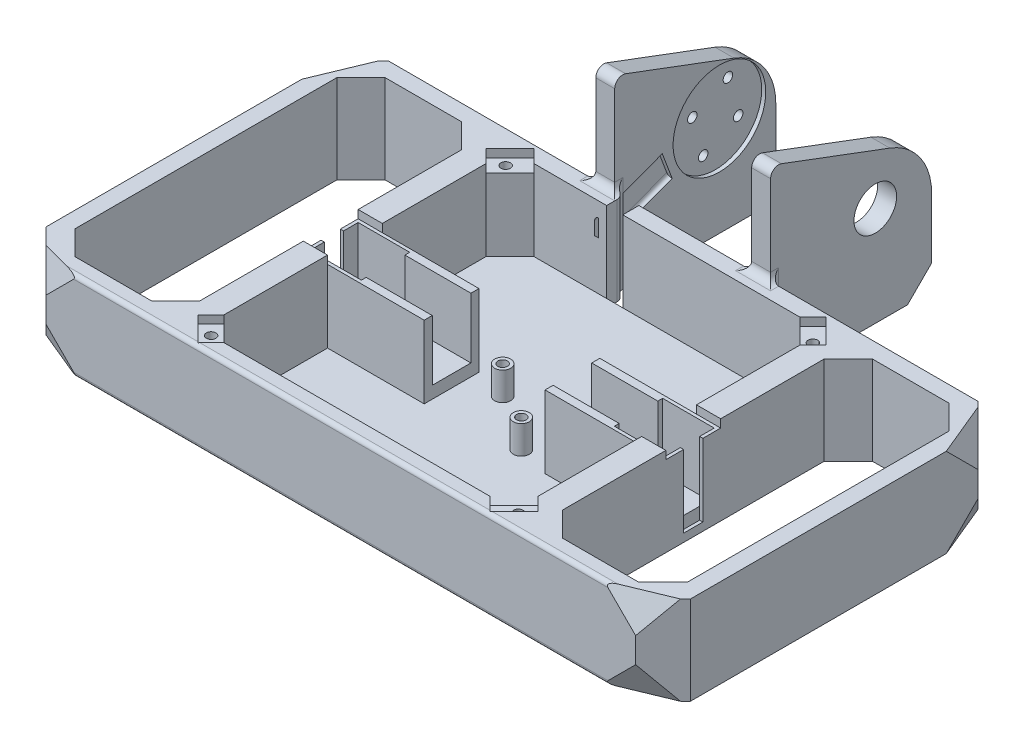
from build123d import *

# Parameters (mm, degrees)
BOSS_EXTRUDE1_DEPTH      = 25.4
BOSS_EXTRUDE1_DEPTH_BACK = 2.54
SKETCH1_W                = 7.62
SKETCH1_H                = 40.259
BOSS_EXTRUDE2_DEPTH      = 2.54
SKETCH4_W                = 1.016
SKETCH4_H                = 3.048
SKETCH4_H_2              = 1.524
BOSS_EXTRUDE3_DEPTH      = 22.86
BOSS_EXTRUDE4_DEPTH      = 5.969
FILLET1_R                = 2.54
FILLET2_R                = 2.54
FILLET3_R                = 20.32
CHAMFER1_SIZE            = 7.62
CHAMFER2_SIZE            = 7.62
CHAMFER3_SIZE            = 7.62
SKETCH7_R                = 14.605
CUT_EXTRUDE2_DEPTH       = 1.27
SKETCH8_R                = 6.731
SKETCH8_R_2              = 2.921
CUT_EXTRUDE3_DEPTH       = 12.7
FILLET5_R                = 2.54
CUT_EXTRUDE4_DEPTH       = 2.54
SKETCH10_R               = 1.5
CUT_EXTRUDE5_DEPTH       = 7.62
SKETCH11_R               = 1.5
CUT_EXTRUDE7_DEPTH       = 7.62
SKETCH12_W               = 5.08
SKETCH12_H               = 27.94
CUT_EXTRUDE8_DEPTH       = 5.08
SKETCH11_3_R             = 2.77
SKETCH11_3_R_2           = 1.5
CUT_EXTRUDE10_DEPTH      = 2.54
SKETCH14_R               = 2.516
SKETCH14_R_2             = 1.5
BOSS_EXTRUDE5_DEPTH      = 8.89
FILLET6_R                = 2.54
CUT_EXTRUDE11_DEPTH      = 1.27
BOSS_EXTRUDE6_DEPTH      = 3.81
FILLET9_R                = 1.27
SKETCH13_R               = 1.5
CUT_EXTRUDE12_DEPTH      = 4.699
FILLET10_R               = 1.27
CHAMFER5_SIZE            = 8.636
CHAMFER6_START           = -81
CHAMFER6_OUTLINE_W       = 17
CHAMFER6_OUTLINE_H       = 13
CHAMFER6_DEPTH           = 3.614919147
CHAMFER7_START           = 85.302688349
CHAMFER7_OUTLINE_W       = 21
CHAMFER7_OUTLINE_H       = 15
CHAMFER7_DEPTH           = 4.697311651
CHAMFER8_START           = 109.374719125
CHAMFER8_OUTLINE_W       = 17
CHAMFER8_OUTLINE_H       = 17
CHAMFER8_DEPTH           = 4.625280875
CHAMFER9_START           = -114
CHAMFER9_OUTLINE_W       = 17
CHAMFER9_OUTLINE_H       = 17
CHAMFER9_DEPTH           = 4.625280875
CHAMFER10_START          = -106
CHAMFER10_OUTLINE_W      = 17
CHAMFER10_OUTLINE_H      = 17
CHAMFER10_DEPTH          = 4.79559905
CHAMFER11_START          = 101.20440095
CHAMFER11_OUTLINE_W      = 17
CHAMFER11_OUTLINE_H      = 17
CHAMFER11_DEPTH          = 4.79559905
CHAMFER12_START          = 77.132370173
CHAMFER12_OUTLINE_W      = 21
CHAMFER12_OUTLINE_H      = 15
CHAMFER12_DEPTH          = 4.867629827
CHAMFER13_START          = -82
CHAMFER13_OUTLINE_W      = 21
CHAMFER13_OUTLINE_H      = 15
CHAMFER13_DEPTH          = 4.867629827
FILLET12_R               = 1.27


with BuildPart() as part:
    # Sketch1 → Boss-Extrude1 (new, two sides: drawn at the far end of the back side and taken through both)
    with BuildSketch(Plane(origin=(0, 0, 0), x_dir=(1, 0, 0), z_dir=(0, 1, 0)).offset(-BOSS_EXTRUDE1_DEPTH_BACK)):
        Polygon((-96.52, 48.895), (-57.15, 48.895), (-57.15, 53.975), (-101.6, 53.975), (-101.6, -53.975), (-57.15, -53.975), (-57.15, -48.895), (-96.52, -48.895), align=None)
        Polygon((-49.53, 48.895), (49.53, 48.895), (57.15, 48.895), (57.15, 53.975), (-57.15, 53.975), (-57.15, 48.895), align=None)
        Polygon((57.15, -53.975), (57.15, -48.895), (49.53, -48.895), (-49.53, -48.895), (-57.15, -48.895), (-57.15, -53.975), align=None)
        Polygon((57.15, 53.975), (57.15, 48.895), (96.52, 48.895), (96.52, -48.895), (57.15, -48.895), (57.15, -53.975), (101.6, -53.975), (101.6, 53.975), align=None)
        with Locations((-53.34, 28.7655)):
            Rectangle(SKETCH1_W, SKETCH1_H)
        with Locations((-53.34, -28.7655)):
            Rectangle(SKETCH1_W, SKETCH1_H)
        with Locations((53.34, 28.7655)):
            Rectangle(SKETCH1_W, SKETCH1_H)
        with Locations((53.34, -28.7655)):
            Rectangle(SKETCH1_W, SKETCH1_H)
    extrude(amount=BOSS_EXTRUDE1_DEPTH + BOSS_EXTRUDE1_DEPTH_BACK)

    # Sketch1<3> → Boss-Extrude2 (add)
    with BuildSketch(Plane(origin=(0, 0, 0), x_dir=(1, 0, 0), z_dir=(0, 1, 0))):
        Polygon((49.53, 8.636), (49.53, 48.895), (-49.53, 48.895), (-49.53, 8.636), (-57.15, 8.636), (-57.15, -8.636), (-49.53, -8.636), (-49.53, -48.895), (49.53, -48.895), (49.53, -8.636), (57.15, -8.636), (57.15, 8.636), align=None)
    extrude(amount=-BOSS_EXTRUDE2_DEPTH)

    # Sketch4 → Boss-Extrude3 (add)
    with BuildSketch(Plane(origin=(0, 0, 0), x_dir=(1, 0, 0), z_dir=(0, 1, 0))):
        Polygon((-49.53, 8.636), (-57.15, 8.636), (-57.15, 7.62), (-56.134, 7.62), (-39.878, 7.62), (-39.878, 6.096), (-21.59, 6.096), (-19.05, 6.096), (-19.05, 8.636), align=None)
        Polygon((-57.15, -7.62), (-57.15, -8.636), (-49.53, -8.636), (-19.05, -8.636), (-19.05, -6.096), (-21.59, -6.096), (-39.878, -6.096), (-39.878, -7.62), (-56.134, -7.62), align=None)
        with Locations((-56.642, -4.572)):
            Rectangle(SKETCH4_W, SKETCH4_H)
        with Locations((-56.642, -6.858)):
            Rectangle(SKETCH4_W, SKETCH4_H_2)
        with Locations((-56.642, 6.858)):
            Rectangle(SKETCH4_W, SKETCH4_H_2)
        with Locations((-56.642, 4.572)):
            Rectangle(SKETCH4_W, SKETCH4_H)
        Polygon((19.05, -8.636), (49.53, -8.636), (57.15, -8.636), (57.15, -7.62), (56.134, -7.62), (39.878, -7.62), (39.878, -6.096), (21.59, -6.096), (19.05, -6.096), align=None)
        Polygon((57.15, 8.636), (49.53, 8.636), (19.05, 8.636), (19.05, 6.096), (21.59, 6.096), (39.878, 6.096), (39.878, 7.62), (56.134, 7.62), (57.15, 7.62), align=None)
        with Locations((56.642, -4.572)):
            Rectangle(SKETCH4_W, SKETCH4_H)
        with Locations((56.642, -6.858)):
            Rectangle(SKETCH4_W, SKETCH4_H_2)
        with Locations((56.642, 4.572)):
            Rectangle(SKETCH4_W, SKETCH4_H)
        with Locations((56.642, 6.858)):
            Rectangle(SKETCH4_W, SKETCH4_H_2)
    extrude(amount=BOSS_EXTRUDE3_DEPTH)

    # Sketch6 → Boss-Extrude4 (add)
    with BuildSketch(Plane.ZY.offset(21.59)):
        Polygon((-53.975, -2.54), (-53.975, 57.15), (-104.775, 38.1), (-104.775, -2.54), align=None)
    extrude(amount=BOSS_EXTRUDE4_DEPTH)

    # Fillet1
    fillet1_edges = [part.edges().sort_by_distance(p)[0] for p in [
        (-27.559, 11.43, -53.975),
        (-21.59, 11.43, -53.975),
    ]]
    fillet(fillet1_edges, radius=FILLET1_R)

    # Fillet2
    fillet2_edges = [part.edges().sort_by_distance(p)[0] for p in [
        (-21.59, 25.4, -55.245),
        (-27.559, 25.4, -55.245),
        (-24.5745, 25.4, -53.975),
    ]]
    fillet(fillet2_edges, radius=FILLET2_R - 0.0001)  # a hair under: the kernel refuses the full size

    # Fillet3
    fillet3_edges = [part.edges().sort_by_distance(p)[0] for p in [
        (-24.5745, 38.1, -104.775),
    ]]
    fillet(fillet3_edges, radius=FILLET3_R)

    # Chamfer1
    chamfer1_edges = [part.edges().sort_by_distance(p)[0] for p in [
        (-24.5745, -2.54, -104.775),
    ]]
    chamfer(chamfer1_edges, length=CHAMFER1_SIZE)

    # Mirror3: part across plane


with BuildPart() as part_1:
    add(part.part)
    add(part.part.mirror(Plane.ZY))

    # Chamfer2
    chamfer2_edges = [part_1.edges().sort_by_distance(p)[0] for p in [
        (-57.15, 11.43, -48.895),
        (-96.52, 11.43, -48.895),
        (-96.52, 11.43, 48.895),
        (-57.15, 11.43, 48.895),
        (57.15, 11.43, 48.895),
        (96.52, 11.43, 48.895),
        (96.52, 11.43, -48.895),
        (57.15, 11.43, -48.895),
    ]]
    chamfer(chamfer2_edges, length=CHAMFER2_SIZE)

    # Chamfer3
    chamfer3_edges = [part_1.edges().sort_by_distance(p)[0] for p in [
        (49.53, 12.7, -48.895),
        (49.53, 12.7, 48.895),
        (-49.53, 12.7, 48.895),
        (-49.53, 12.7, -48.895),
    ]]
    chamfer(chamfer3_edges, length=CHAMFER3_SIZE)

    # Sketch7 → Cut-Extrude2 (cut)
    with BuildSketch(Plane(origin=(-21.59, 0, 0), x_dir=(0, 0, -1), z_dir=(1, 0, 0))):
        with Locations((86.995, 28.829)):
            Circle(SKETCH7_R)
    extrude(amount=-CUT_EXTRUDE2_DEPTH, mode=Mode.SUBTRACT)

    # Sketch8 → Cut-Extrude3 (cut)
    # profile 1 of 2: a face of its own
    with BuildSketch(Plane.ZY.offset(-21.59)):
        with Locations((-86.995, 28.829)):
            Circle(SKETCH8_R)
        with Locations((-86.995, 28.829)):
            Circle(SKETCH8_R_2, mode=Mode.SUBTRACT)
    # profile 2 of 2: a face of its own
    with BuildSketch(Plane.ZY.offset(-21.59)):
        with Locations((-86.995, 28.829)):
            Circle(SKETCH8_R_2)
    extrude(amount=-CUT_EXTRUDE3_DEPTH, mode=Mode.SUBTRACT)

    # Fillet5
    fillet5_edges = [part_1.edges().sort_by_distance(p)[0] for p in [
        (-24.5745, 57.15, -53.975),
        (24.5745, 57.15, -53.975),
    ]]
    fillet(fillet5_edges, radius=FILLET5_R)

    # Sketch9 → Cut-Extrude4 (cut)
    with BuildSketch(Plane(origin=(0, 25.4, 0), x_dir=(1, 0, 0), z_dir=(0, 1, 0))):
        Polygon((-53.660917816, 45.405917816), (-46.040917816, 53.025917816), (-41.91, 48.895), (-49.53, 41.275), align=None)
        Polygon((-49.53, -41.275), (-41.91, -48.895), (-46.040917816, -53.025917816), (-53.660917816, -45.405917816), align=None)
        Polygon((49.53, -41.275), (53.660917816, -45.405917816), (46.040917816, -53.025917816), (41.91, -48.895), align=None)
        Polygon((49.53, 41.275), (41.91, 48.895), (46.040917816, 53.025917816), (53.660917816, 45.405917816), align=None)
    extrude(amount=-CUT_EXTRUDE4_DEPTH, mode=Mode.SUBTRACT)

    # Sketch10 → Cut-Extrude5 (cut)
    with BuildSketch(Plane(origin=(0, 25.4, 0), x_dir=(1, 0, 0), z_dir=(0, 1, 0))):
        with Locations(Location((-48.429665944, 46.434409823, 0), (0, 0, 270))):
            Circle(SKETCH10_R)
        with Locations(Location((48.429665944, 46.434409823, 0), (0, 0, 270))):
            Circle(SKETCH10_R)
        with Locations(Location((48.429665944, -46.434409823, 0), (0, 0, 270))):
            Circle(SKETCH10_R)
        with Locations(Location((-48.429665944, -46.434409823, 0), (0, 0, 270))):
            Circle(SKETCH10_R)
    extrude(amount=-CUT_EXTRUDE5_DEPTH, mode=Mode.SUBTRACT)

    # Sketch11 → Cut-Extrude7 (cut)
    with BuildSketch(Plane.ZY.offset(27.559)):
        with Locations((-90.938422753, 37.471882447)):
            Circle(SKETCH11_R)
        with Locations((-94.182835657, 25.396190057)):
            Circle(SKETCH11_R)
        with Locations((-79.716783202, 32.149777055)):
            Circle(SKETCH11_R)
        with Locations((-83.142635981, 19.98962148)):
            Circle(SKETCH11_R)
    extrude(amount=-CUT_EXTRUDE7_DEPTH, mode=Mode.SUBTRACT)

    # Sketch12 → Cut-Extrude8 (cut)
    with BuildSketch(Plane(origin=(0, 0, -53.975), x_dir=(-1, 0, 0), z_dir=(0, 0, -1))):
        with Locations((16.51, 11.43)):
            Rectangle(SKETCH12_W, SKETCH12_H)
    extrude(amount=-CUT_EXTRUDE8_DEPTH, mode=Mode.SUBTRACT)

    # Sketch11<3> → Cut-Extrude10 (cut)
    # profile 1 of 4: a face of its own
    with BuildSketch(Plane.ZY.offset(27.559)):
        with Locations((-90.938422753, 37.471882447)):
            Circle(SKETCH11_3_R)
        with Locations((-90.938422753, 37.471882447)):
            Circle(SKETCH11_3_R_2, mode=Mode.SUBTRACT)
    # profile 2 of 4: a face of its own
    with BuildSketch(Plane.ZY.offset(27.559)):
        with Locations((-79.716783202, 32.149777055)):
            Circle(SKETCH11_3_R)
        with Locations((-79.716783202, 32.149777055)):
            Circle(SKETCH11_3_R_2, mode=Mode.SUBTRACT)
    # profile 3 of 4: a face of its own
    with BuildSketch(Plane.ZY.offset(27.559)):
        with Locations((-94.182835657, 25.396190057)):
            Circle(SKETCH11_3_R)
        with Locations((-94.182835657, 25.396190057)):
            Circle(SKETCH11_3_R_2, mode=Mode.SUBTRACT)
    # profile 4 of 4: a face of its own
    with BuildSketch(Plane.ZY.offset(27.559)):
        with Locations((-83.142635981, 19.98962148)):
            Circle(SKETCH11_3_R)
        with Locations((-83.142635981, 19.98962148)):
            Circle(SKETCH11_3_R_2, mode=Mode.SUBTRACT)
    extrude(amount=-CUT_EXTRUDE10_DEPTH, mode=Mode.SUBTRACT)

    # Sketch14 → Boss-Extrude5 (add)
    # profile 1 of 2: a face of its own
    with BuildSketch(Plane(origin=(0, 0, 0), x_dir=(1, 0, 0), z_dir=(0, 1, 0))):
        with Locations(Location((-8.777935056, 5.836140605, 0), (0, 0, 90))):
            Circle(SKETCH14_R)
        with Locations(Location((-8.777935056, 5.836140605, 0), (0, 0, 90))):
            Circle(SKETCH14_R_2, mode=Mode.SUBTRACT)
    # profile 2 of 2: a face of its own
    with BuildSketch(Plane(origin=(0, 0, 0), x_dir=(1, 0, 0), z_dir=(0, 1, 0))):
        with Locations(Location((8.777935056, -5.836140605, 0), (0, 0, 90))):
            Circle(SKETCH14_R)
        with Locations(Location((8.777935056, -5.836140605, 0), (0, 0, 90))):
            Circle(SKETCH14_R_2, mode=Mode.SUBTRACT)
    extrude(amount=BOSS_EXTRUDE5_DEPTH)

    # Fillet6
    fillet6_edges = [part_1.edges().sort_by_distance(p)[0] for p in [
        (-19.05, 11.43, -53.975),
    ]]
    fillet(fillet6_edges, radius=FILLET6_R)

    # Sketch15 → Cut-Extrude11 (cut)
    with BuildSketch(Plane(origin=(-21.59, 0, 0), x_dir=(0, 0, -1), z_dir=(1, 0, 0))):
        Polygon((68.976614426, 28.250302251), (72.107011743, 19.929682524), (50.23566846, 11.701209579), (47.105271144, 20.021829306), align=None)
    extrude(amount=-CUT_EXTRUDE11_DEPTH, mode=Mode.SUBTRACT)

    # Sketch16 → Boss-Extrude6 (add)
    with BuildSketch(Plane(origin=(0, 0, 0), x_dir=(1, 0, 0), z_dir=(0, 1, 0))):
        Polygon((56.134, 3.048), (56.134, 6.096), (39.878, 6.096), (19.05, 6.096), (19.05, -6.096), (39.878, -6.096), (56.134, -6.096), (56.134, -3.048), align=None)
        Polygon((-19.05, -6.096), (-19.05, 6.096), (-39.878, 6.096), (-56.134, 6.096), (-56.134, 3.048), (-56.134, -3.048), (-56.134, -6.096), (-39.878, -6.096), align=None)
    extrude(amount=BOSS_EXTRUDE6_DEPTH)

    # Fillet9
    fillet9_edges = [part_1.edges().sort_by_distance(p)[0] for p in [
        (48.006, 0, 6.096),
        (48.006, 0, -6.096),
        (-48.006, 0, -6.096),
        (-48.006, 0, 6.096),
    ]]
    fillet(fillet9_edges, radius=FILLET9_R)

    # Sketch13 → Cut-Extrude12 (cut)
    with BuildSketch(Plane(origin=(0, 0, -53.975), x_dir=(-1, 0, 0), z_dir=(0, 0, -1))):
        with Locations((33.909, 20.32)):
            Circle(SKETCH13_R)
        with Locations((33.909, 7.62)):
            Circle(SKETCH13_R)
        with Locations((90.17, 20.32)):
            Circle(SKETCH13_R)
        with Locations((90.17, 7.62)):
            Circle(SKETCH13_R)
        with Locations((-90.17, 20.32)):
            Circle(SKETCH13_R)
        with Locations((-90.17, 7.62)):
            Circle(SKETCH13_R)
        with Locations((-33.909, 20.32)):
            Circle(SKETCH13_R)
        with Locations((-33.909, 7.62)):
            Circle(SKETCH13_R)
    extrude(amount=-CUT_EXTRUDE12_DEPTH, mode=Mode.SUBTRACT)

    # Fillet10
    fillet10_edges = [part_1.edges().sort_by_distance(p)[0] for p in [
        (-22.86, 24.472733154, -58.935807213),
        (-22.86, 15.815446052, -61.171340101),
    ]]
    fillet(fillet10_edges, radius=FILLET10_R - 0.0001)  # a hair under: the kernel refuses the full size

    # Chamfer5
    chamfer5_edges = [part_1.edges().sort_by_distance(p)[0] for p in [
        (101.6, 11.43, 53.975),
        (-101.6, 11.43, 53.975),
        (-101.6, 11.43, -53.975),
        (101.6, 11.43, -53.975),
    ]]
    chamfer(chamfer5_edges, length=CHAMFER5_SIZE)

    # Chamfer6: read off the stored shape, not the designer's step
    # Chamfer6 outline → Chamfer6 (cut)
    with BuildSketch(Plane(origin=(0, 0, 0), x_dir=(0.9688741787878279, 0.06325158314662055, 0.23933671450000762), z_dir=(0.2475536824169901, -0.2475536824169901, -0.9367146570026414)).offset(CHAMFER6_START)):
        with Locations((-72.5, -6.5)):
            Rectangle(CHAMFER6_OUTLINE_W, CHAMFER6_OUTLINE_H)
    extrude(amount=CHAMFER6_DEPTH, mode=Mode.SUBTRACT)

    # Chamfer7: read off the stored shape, not the designer's step
    # Chamfer7 outline → Chamfer7 (cut)
    with BuildSketch(Plane(origin=(0, 0, 0), x_dir=(0.9339488310944645, -0.13677363967316025, -0.33020077587407337), z_dir=(0.35740674433659403, 0.35740674433659403, 0.8628562094610163)).offset(CHAMFER7_START)):
        with Locations((65.5, -0.5)):
            Rectangle(CHAMFER7_OUTLINE_W, CHAMFER7_OUTLINE_H)
    extrude(amount=CHAMFER7_DEPTH, mode=Mode.SUBTRACT)

    # Chamfer8: read off the stored shape, not the designer's step
    # Chamfer8 outline → Chamfer8 (cut)
    with BuildSketch(Plane(origin=(0, 0, 0), x_dir=(0.5054494651244241, -0.6101314768988049, 0.6101314768988049), z_dir=(0.8628562094610164, 0.35740674433659403, -0.3574067443365941)).offset(CHAMFER8_START)):
        with Locations((7.5, 14.5)):
            Rectangle(CHAMFER8_OUTLINE_W, CHAMFER8_OUTLINE_H)
    extrude(amount=CHAMFER8_DEPTH, mode=Mode.SUBTRACT)

    # Chamfer9: read off the stored shape, not the designer's step
    # Chamfer9 outline → Chamfer9 (cut)
    with BuildSketch(Plane(origin=(0, 0, 0), x_dir=(0.5054494651244216, 0.6101314768988056, -0.6101314768988058), z_dir=(0.8628562094610179, -0.3574067443365919, 0.357406744336592)).offset(CHAMFER9_START)):
        with Locations((-7.5, -14.5)):
            Rectangle(CHAMFER9_OUTLINE_W, CHAMFER9_OUTLINE_H)
    extrude(amount=CHAMFER9_DEPTH, mode=Mode.SUBTRACT)

    # Chamfer10: read off the stored shape, not the designer's step
    # Chamfer10 outline → Chamfer10 (cut)
    with BuildSketch(Plane(origin=(0, 0, 0), x_dir=(0.5054494651244216, -0.6101314768988056, -0.6101314768988058), z_dir=(0.8628562094610179, 0.3574067443365919, 0.357406744336592)).offset(CHAMFER10_START)):
        with Locations((-21.5, 30.5)):
            Rectangle(CHAMFER10_OUTLINE_W, CHAMFER10_OUTLINE_H)
    extrude(amount=CHAMFER10_DEPTH, mode=Mode.SUBTRACT)

    # Chamfer11: read off the stored shape, not the designer's step
    # Chamfer11 outline → Chamfer11 (cut)
    with BuildSketch(Plane(origin=(0, 0, 0), x_dir=(0.5054494651244241, 0.6101314768988049, 0.6101314768988049), z_dir=(0.8628562094610164, -0.35740674433659403, -0.3574067443365941)).offset(CHAMFER11_START)):
        with Locations((21.5, -30.5)):
            Rectangle(CHAMFER11_OUTLINE_W, CHAMFER11_OUTLINE_H)
    extrude(amount=CHAMFER11_DEPTH, mode=Mode.SUBTRACT)

    # Chamfer12: read off the stored shape, not the designer's step
    # Chamfer12 outline → Chamfer12 (cut)
    with BuildSketch(Plane(origin=(0, 0, 0), x_dir=(0.9339488310944645, 0.13677363967315978, -0.33020077587407337), z_dir=(0.35740674433659386, -0.3574067443365929, 0.8628562094610167)).offset(CHAMFER12_START)):
        with Locations((68.5, 21.5)):
            Rectangle(CHAMFER12_OUTLINE_W, CHAMFER12_OUTLINE_H)
    extrude(amount=CHAMFER12_DEPTH, mode=Mode.SUBTRACT)

    # Chamfer13: read off the stored shape, not the designer's step
    # Chamfer13 outline → Chamfer13 (cut)
    with BuildSketch(Plane(origin=(0, 0, 0), x_dir=(0.9339488310944651, -0.1367736396731588, 0.3302007758740721), z_dir=(0.35740674433659225, 0.3574067443365923, -0.8628562094610177)).offset(CHAMFER13_START)):
        with Locations((-68.5, -21.5)):
            Rectangle(CHAMFER13_OUTLINE_W, CHAMFER13_OUTLINE_H)
    extrude(amount=CHAMFER13_DEPTH, mode=Mode.SUBTRACT)

    # Fillet12
    # the kernel refuses this fillet: 1.27 mm, written as the material it takes off along each edge
    with BuildSketch(Plane(origin=(-88.361499999, 25.4, 53.975), x_dir=(0, 0, -1), z_dir=(1, 0, 0))) as fillet12_piece_1:
        with BuildLine():
            CenterArc((FILLET12_R, -FILLET12_R), FILLET12_R, 90, 90)
            Line((0, -FILLET12_R), (0, 0))
            Line((0, 0), (FILLET12_R, 0))
        make_face()
    extrude(amount=174.5005, mode=Mode.SUBTRACT)
    with BuildSketch(Plane(origin=(86.138999999, -2.54, 53.975), x_dir=(0, 1, 0), z_dir=(-1, 0, 0))) as fillet12_piece_2:
        with BuildLine():
            CenterArc((FILLET12_R, FILLET12_R), FILLET12_R, 180, 90)
            Line((0, FILLET12_R), (0, 0))
            Line((0, 0), (FILLET12_R, 0))
        make_face()
    extrude(amount=172.277999998, mode=Mode.SUBTRACT)


solid = part_1.part
